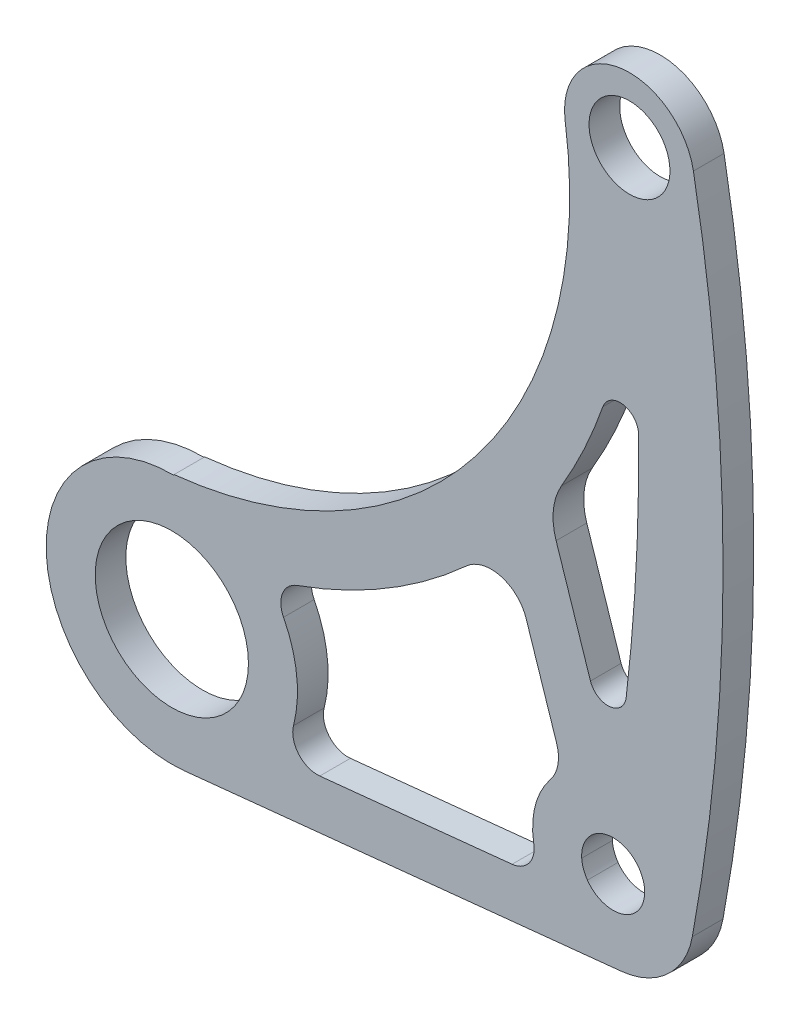
from build123d import *

# Parameters (mm, degrees)
SKETCH2_R           = 7.9375
SKETCH2_R_2         = 4.191
SKETCH2_R_3         = 3.2639
BOSS_EXTRUDE1_DEPTH = 3.175
FILLET1_R           = 2.54
FILLET2_R           = 3.81
FILLET3_R           = 1.905
FILLET4_R           = 6.35


with BuildPart() as part:
    # Sketch2 → Boss-Extrude1 (new body)
    with BuildSketch(Plane.XY):
        with BuildLine():
            Line((1.330677778, -12.949308974), (46.572932, -8.300191215))
            ThreePointArc((46.572932, -8.300191215), (51.37742802, -6.133039654), (53.924522362, -1.518709983))
            ThreePointArc((53.924522362, -1.518709983), (57.106411985, 32.846575472), (54.035830718, 67.22198524))
            ThreePointArc((54.035830718, 67.22198524), (46.333024889, 72.662028043), (40.750647472, 65.061742146))
            ThreePointArc((40.750647472, 65.061742146), (31.550758366, 30.452598432), (0.230104832, 13.090356345))
            Line((0.230104832, 13.090356345), (0.171615761, 13.016368706))
            ThreePointArc((0.171615761, 13.016368706), (-13.004550196, -0.580500165), (1.330677778, -12.949308974))
        make_face()
        Circle(SKETCH2_R, mode=Mode.SUBTRACT)
        with BuildLine():
            ThreePointArc((38.882442516, 29.775817606), (45.039190515, 42.544935267), (47.523781163, 56.501393309))
            ThreePointArc((47.523781163, 56.501393309), (48.257752726, 32.370804269), (45.933946154, 8.34115665))
            Line((45.933946154, 8.34115665), (38.882442516, 29.775817606))
        make_face(mode=Mode.SUBTRACT)
        with BuildLine():
            ThreePointArc((9.848859751, 8.512066016), (23.445327069, 14.632175726), (34.749899024, 24.354640398))
            Line((34.749899024, 24.354640398), (40.595697266, 6.584997244))
            ThreePointArc((40.595697266, 6.584997244), (37.546758205, 1.678923993), (38.414831114, -4.031770672))
            Line((38.414831114, -4.031770672), (11.074870198, -6.841239387))
            ThreePointArc((11.074870198, -6.841239387), (12.976194182, 1.036190528), (9.848859751, 8.512066016))
        make_face(mode=Mode.SUBTRACT)
        with Locations((47.413333333, 66.018287029)):
            Circle(SKETCH2_R_2, mode=Mode.SUBTRACT)
        with Locations((45.72, 0)):
            Circle(SKETCH2_R_3, mode=Mode.SUBTRACT)
    extrude(amount=BOSS_EXTRUDE1_DEPTH)

    # Fillet1
    fillet1_edges = [part.edges().sort_by_distance(p)[0] for p in [
        (11.074870198, -6.841239387, 1.5875),
        (38.414831114, -4.031770672, 1.5875),
        (9.848859751, 8.512066016, 1.5875),
    ]]
    fillet(fillet1_edges, radius=FILLET1_R)

    # Fillet2
    fillet2_edges = [part.edges().sort_by_distance(p)[0] for p in [
        (40.595697266, 6.584997244, 1.5875),
        (34.749899024, 24.354640398, 1.5875),
    ]]
    fillet(fillet2_edges, radius=FILLET2_R)

    # Fillet3
    fillet3_edges = [part.edges().sort_by_distance(p)[0] for p in [
        (45.933946154, 8.34115665, 1.5875),
        (47.523781163, 56.501393309, 1.5875),
    ]]
    fillet(fillet3_edges, radius=FILLET3_R)

    # Fillet4
    fillet4_edges = [part.edges().sort_by_distance(p)[0] for p in [
        (38.882442516, 29.775817606, 1.5875),
    ]]
    fillet(fillet4_edges, radius=FILLET4_R)


solid = part.part
